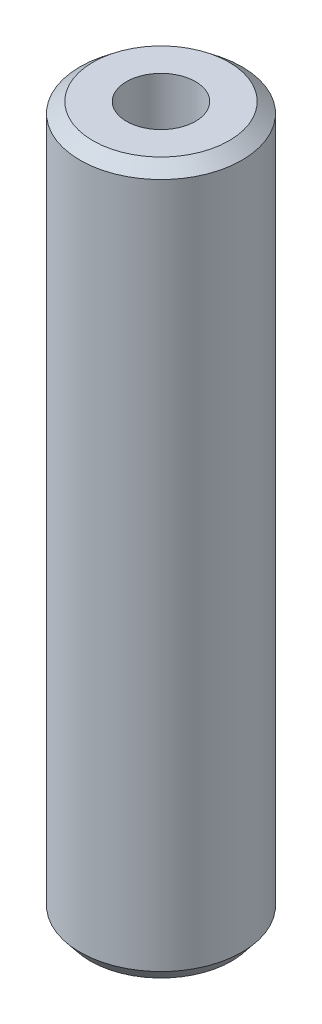
from build123d import *
from OCP.BRepFilletAPI import BRepFilletAPI_MakeChamfer

# Parameters (mm, degrees)
SKETCH1_R           = 27.5
BOSS_EXTRUDE1_DEPTH = 240.820918369
SKETCH2_R           = 11.706873025
CUT_EXTRUDE1_DEPTH  = 244.941006647
CHAMFER1_SIZE       = 3.526420021
CHAMFER1_SIZE2      = 4.390470239


with BuildPart() as part:
    # Sketch1 → Boss-Extrude1 (new body)
    with BuildSketch(Plane(origin=(0, 0, 0), x_dir=(1, 0, 0), z_dir=(0, 1, 0))):
        Circle(SKETCH1_R)
    extrude(amount=BOSS_EXTRUDE1_DEPTH)

    # Sketch2 → Cut-Extrude1 (cut, through all)
    with BuildSketch(Plane(origin=(0, 0, 0), x_dir=(1, 0, 0), z_dir=(0, 1, 0))):
        Circle(SKETCH2_R)
    extrude(amount=CUT_EXTRUDE1_DEPTH, mode=Mode.SUBTRACT)

    # Chamfer1: one chamfer whose edges measure the first distance from different faces: ONE call of the kernel's chamfer builder (chamfer() names one face for all edges)
    chamfer1_edges_1 = [part.edges().sort_by_distance(p)[0] for p in [
        (-27.5, 240.820918369, 0),
    ]]
    chamfer1_side_1 = [part.faces().sort_by_distance(p)[0] for p in [
        (-27.5, 120.410459184, 0),
    ]]
    chamfer1_edges_2 = [part.edges().sort_by_distance(p)[0] for p in [
        (-27.5, 0, 0),
    ]]
    chamfer1_side_2 = [part.faces().sort_by_distance(p)[0] for p in [
        (-26.722182541, 0, 0),
    ]]
    chamfer1 = BRepFilletAPI_MakeChamfer(part.part.solid().wrapped)
    for e in chamfer1_edges_1:
        chamfer1.Add(CHAMFER1_SIZE, CHAMFER1_SIZE2, e.wrapped, chamfer1_side_1[0].wrapped)  # the first distance lies on this face
    for e in chamfer1_edges_2:
        chamfer1.Add(CHAMFER1_SIZE, CHAMFER1_SIZE2, e.wrapped, chamfer1_side_2[0].wrapped)  # the first distance lies on this face
    add(Compound.cast(chamfer1.Shape()), mode=Mode.REPLACE)


solid = part.part
